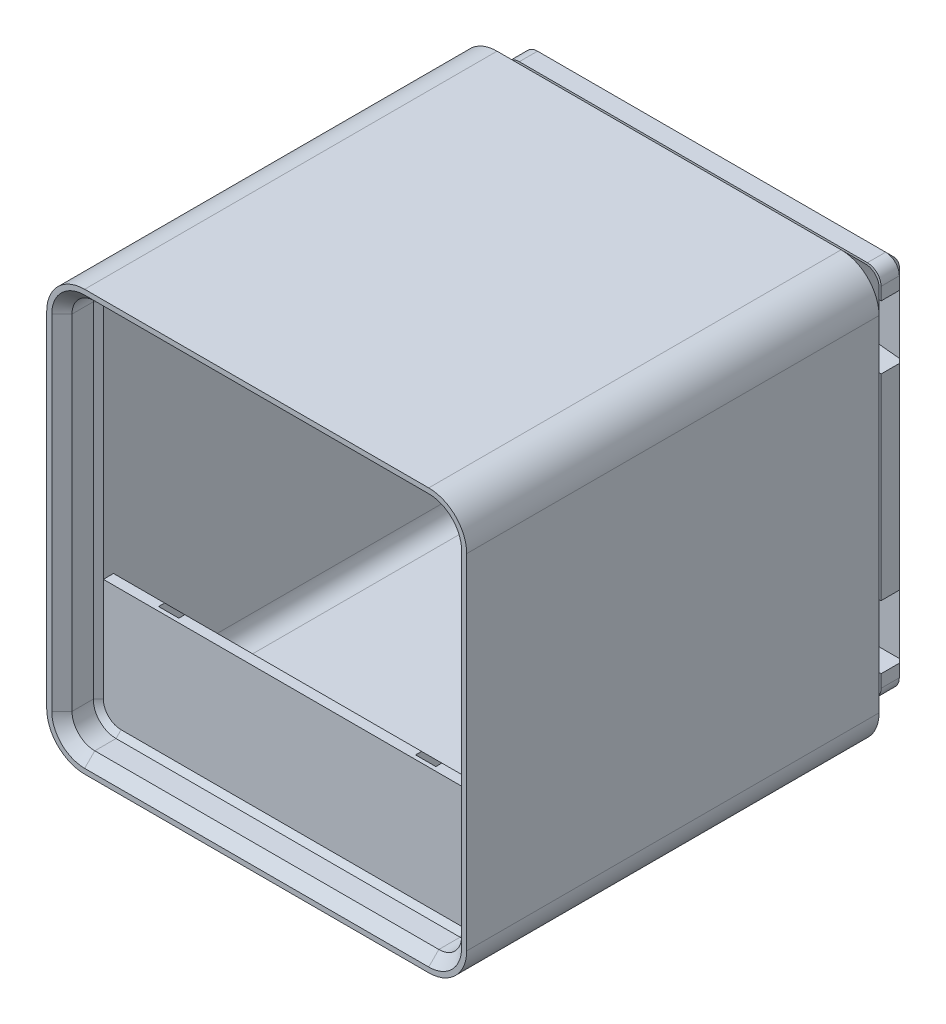
from build123d import *

# Parameters (mm, degrees)
SKETCH1_W              = 37.1
SKETCH1_H              = 37.1
BOSS_EXTRUDE1_DEPTH    = 2.6
SKETCH2_W              = 41.5
SKETCH2_H              = 41.5
BOSS_EXTRUDE2_DEPTH    = 2.4
BASE_START             = -0.4
BASE_MAGNET_SLOT_DEPTH = 2.6
CUT_EXTRUDE1_START     = -5
CUT_EXTRUDE1_DEPTH     = 5
MIRROR2_START          = -0.4
MIRROR2_COPY_1_DEPTH   = 2.6
MIRROR2_START_2        = -5
MIRROR2_COPY_2_DEPTH   = 5
FILLET1_R              = 1.35
FILLET2_R              = 3.75
CHAMFER1_SIZE          = 0.8
CHAMFER2_SIZE          = 2.4
SIDE_WALLS_DEPTH       = 36.85
BOSS_EXTRUDE4_DEPTH    = 3.9
CHAMFER3_SIZE          = 0.8
CHAMFER4_SIZE          = 1
INTERNAL_RAMP_REACH    = 65.905
BOSS_EXTRUDE6_DEPTH    = 12
CHAMFER5_SIZE          = 11
CUT_EXTRUDE2_DEPTH     = 2.6


# Some blends are built 0.0001 mm under size
with BuildPart() as part:
    # Sketch1 → Boss-Extrude1 (new body)
    with BuildSketch(Plane.XY):
        Rectangle(SKETCH1_W, SKETCH1_H)
    extrude(amount=BOSS_EXTRUDE1_DEPTH)

    # Sketch8 → Base Magnet Slot (cut)
    with BuildSketch(Plane(origin=(0, 0, 2.6), x_dir=(-1, 0, 0), z_dir=(0, 0, -1)).offset(BASE_START)):
        with BuildLine():
            Line((-14.65, 10.1), (-18.55, 9.7))
            Line((-18.55, 9.7), (-18.55, 15.95))
            Line((-18.55, 15.95), (-12.7, 15.95))
            ThreePointArc((-12.7, 15.95), (-9.45, 12.7), (-12.7, 9.45))
            ThreePointArc((-12.7, 9.45), (-13.72774024, 9.616779281), (-14.65, 10.1))
        make_face()
    base_magnet_slot = extrude(amount=BASE_MAGNET_SLOT_DEPTH, mode=Mode.SUBTRACT)

    # Sketch12 → Cut-Extrude1 (cut)
    with BuildSketch(Plane(origin=(0, 0, 0), x_dir=(-1, 0, 0), z_dir=(0, 0, -1)).offset(CUT_EXTRUDE1_START)):
        with BuildLine():
            Line((-12.7, 13.7), (-6.2, 13.7))
            ThreePointArc((-6.2, 13.7), (-5.2, 12.7), (-6.2, 11.7))
            Line((-6.2, 11.7), (-12.7, 11.7))
            ThreePointArc((-12.7, 11.7), (-13.7, 12.7), (-12.7, 13.7))
        make_face()
    cut_extrude1 = extrude(amount=CUT_EXTRUDE1_DEPTH, mode=Mode.SUBTRACT)

    # Mirror1: Base Magnet Slot, Cut-Extrude1 across plane
    add(base_magnet_slot.mirror(Plane.ZX), mode=Mode.SUBTRACT)
    add(cut_extrude1.mirror(Plane.ZX), mode=Mode.SUBTRACT)

    # Mirror2: Base Magnet Slot, Cut-Extrude1 across plane
    add(base_magnet_slot.mirror(Plane(origin=(0, 0, 0), x_dir=(0, 0, 1), z_dir=(1, 0, 0))), mode=Mode.SUBTRACT)
    add(cut_extrude1.mirror(Plane(origin=(0, 0, 0), x_dir=(0, 0, 1), z_dir=(1, 0, 0))), mode=Mode.SUBTRACT)

    # Mirror2 copy 1 sketch → Mirror2 copy 1 (cut)
    with BuildSketch(Plane(origin=(0, 0, 2.6), x_dir=(1, 0, 0), z_dir=(0, 0, -1)).offset(MIRROR2_START)):
        with BuildLine():
            Line((-14.65, 10.1), (-18.55, 9.7))
            Line((-18.55, 9.7), (-18.55, 15.95))
            Line((-18.55, 15.95), (-12.7, 15.95))
            ThreePointArc((-12.7, 15.95), (-9.45, 12.7), (-12.7, 9.45))
            ThreePointArc((-12.7, 9.45), (-13.72774024, 9.616779281), (-14.65, 10.1))
        make_face()
    extrude(amount=MIRROR2_COPY_1_DEPTH, mode=Mode.SUBTRACT)

    # Mirror2 copy 2 sketch → Mirror2 copy 2 (cut)
    with BuildSketch(Plane(origin=(0, 0, 0), x_dir=(1, 0, 0), z_dir=(0, 0, -1)).offset(MIRROR2_START_2)):
        with BuildLine():
            Line((-12.7, 13.7), (-6.2, 13.7))
            ThreePointArc((-6.2, 13.7), (-5.2, 12.7), (-6.2, 11.7))
            Line((-6.2, 11.7), (-12.7, 11.7))
            ThreePointArc((-12.7, 11.7), (-13.7, 12.7), (-12.7, 13.7))
        make_face()
    extrude(amount=MIRROR2_COPY_2_DEPTH, mode=Mode.SUBTRACT)

    # Fillet1
    fillet1_edges = [part.edges().sort_by_distance(p)[0] for p in [
        (-18.55, 18.55, 1.3),
        (18.55, 18.55, 1.3),
        (18.55, -18.55, 1.3),
        (-18.55, -18.55, 1.3),
    ]]
    fillet(fillet1_edges, radius=FILLET1_R)

    # Chamfer1
    # the kernel refuses this chamfer: 0.8 mm, written as the material it takes off along each edge
    with BuildSketch(Plane(origin=(-17.2, 17.2, 0), x_dir=(0, 1, 0), z_dir=(1, 0, 0))) as chamfer1_piece_1:
        Polygon((1.35 - CHAMFER1_SIZE, 0), (1.35, CHAMFER1_SIZE), (1.35, 0), align=None)
    revolve(axis=Axis((-17.2, 17.2, 0), (0, 0, 1)), revolution_arc=90, mode=Mode.SUBTRACT)
    with BuildSketch(Plane(origin=(-18.55, 17.2, 0), x_dir=(0.9996219169112968, 0, -0.027495876610586313), z_dir=(0, -1, 0)), Plane(origin=(-17.2, -18.55, 0), x_dir=(0, 0.9996219169112968, -0.027495876610586313), z_dir=(1, 0, 0)), Plane(origin=(18.55, -17.2, 0), x_dir=(-0.9996219169112968, 0, -0.027495876610586313), z_dir=(0, 1, 0))) as chamfer1_piece_2:
        Polygon((CHAMFER1_SIZE * 0.999621916911, CHAMFER1_SIZE * 0.0274958766106), (-CHAMFER1_SIZE * 0.0274958766106, CHAMFER1_SIZE * 0.999621916911), (0, 0), align=None)
    extrude(amount=34.4, mode=Mode.SUBTRACT)
    with BuildSketch(Plane(origin=(-17.2, -17.2, 0), x_dir=(-1, 0, 0), z_dir=(0, 1, 0))) as chamfer1_piece_3:
        Polygon((1.35 - CHAMFER1_SIZE, 0), (1.35, CHAMFER1_SIZE), (1.35, 0), align=None)
    revolve(axis=Axis((-17.2, -17.2, 0), (0, 0, 1)), revolution_arc=90, mode=Mode.SUBTRACT)
    with BuildSketch(Plane(origin=(17.2, -17.2, 0), x_dir=(1, 0, 0), z_dir=(0, 1, 0))) as chamfer1_piece_4:
        Polygon((1.35 - CHAMFER1_SIZE, 0), (1.35, -CHAMFER1_SIZE), (1.35, 0), align=None)
    revolve(axis=Axis((17.2, -17.2, 0), (0, 0, -1)), revolution_arc=90, mode=Mode.SUBTRACT)
    with BuildSketch(Plane(origin=(17.2, 17.2, 0), x_dir=(0, 1, 0), z_dir=(-1, 0, 0))) as chamfer1_piece_5:
        Polygon((1.35 - CHAMFER1_SIZE, 0), (1.35, -CHAMFER1_SIZE), (1.35, 0), align=None)
    revolve(axis=Axis((17.2, 17.2, 0), (0, 0, -1)), revolution_arc=90, mode=Mode.SUBTRACT)
    with BuildSketch(Plane(origin=(17.2, 18.55, 0), x_dir=(0, 0.02749587661058735, 0.9996219169112966), z_dir=(-1, 0, 0))) as chamfer1_piece_6:
        Polygon((CHAMFER1_SIZE * 0.999621916911, -CHAMFER1_SIZE * 0.0274958766106), (-CHAMFER1_SIZE * 0.0274958766106, -CHAMFER1_SIZE * 0.999621916911), (0, 0), align=None)
    extrude(amount=34.4, mode=Mode.SUBTRACT)


with BuildPart() as body_2:
    # Sketch2 → Boss-Extrude2 (new body)
    with BuildSketch(Plane.XY.offset(2.6)):
        Rectangle(SKETCH2_W, SKETCH2_H)
    extrude(amount=BOSS_EXTRUDE2_DEPTH)

    # Fillet2
    fillet2_edges = [body_2.edges().sort_by_distance(p)[0] for p in [
        (20.75, -20.75, 3.8),
        (-20.75, -20.75, 3.8),
        (-20.75, 20.75, 3.8),
        (20.75, 20.75, 3.8),
    ]]
    fillet(fillet2_edges, radius=FILLET2_R)

    # Chamfer2
    chamfer2_edges = [body_2.edges().sort_by_distance(p)[0] for p in [
        (20.75, 0, 2.6),
        (19.651650429, 19.651650429, 2.6),
        (19.651650429, -19.651650429, 2.6),
        (0, 20.75, 2.6),
        (0, -20.75, 2.6),
        (-19.651650429, 19.651650429, 2.6),
        (-19.651650429, -19.651650429, 2.6),
        (-20.75, 0, 2.6),
    ]]
    chamfer(chamfer2_edges, length=CHAMFER2_SIZE - 0.0001)  # a hair under: the kernel refuses the full size


with BuildPart() as body_3:
    # Sketch5 → Side Walls (new body)
    with BuildSketch(Plane.XY.offset(5)):
        with BuildLine():
            Line((-17, -20.75), (17, -20.75))
            ThreePointArc((17, -20.75), (19.651650429, -19.651650429), (20.75, -17))
            Line((20.75, -17), (20.75, 17))
            ThreePointArc((20.75, 17), (19.651650429, 19.651650429), (17, 20.75))
            Line((17, 20.75), (-17, 20.75))
            ThreePointArc((-17, 20.75), (-19.651650429, 19.651650429), (-20.75, 17))
            Line((-20.75, 17), (-20.75, -17))
            ThreePointArc((-20.75, -17), (-19.651650429, -19.651650429), (-17, -20.75))
        make_face()
        with BuildLine():
            Line((-17, -18.75), (17, -18.75))
            ThreePointArc((17, -18.75), (18.237436867, -18.237436867), (18.75, -17))
            Line((18.75, -17), (18.75, 17))
            ThreePointArc((18.75, 17), (18.237436867, 18.237436867), (17, 18.75))
            Line((17, 18.75), (-17, 18.75))
            ThreePointArc((-17, 18.75), (-18.237436867, 18.237436867), (-18.75, 17))
            Line((-18.75, 17), (-18.75, -17))
            ThreePointArc((-18.75, -17), (-18.237436867, -18.237436867), (-17, -18.75))
        make_face(mode=Mode.SUBTRACT)
    extrude(amount=SIDE_WALLS_DEPTH)

    # Sketch11 → Boss-Extrude4 (add)
    with BuildSketch(Plane.XY.offset(41.85)):
        with BuildLine():
            Line((-17, -20.75), (17, -20.75))
            ThreePointArc((17, -20.75), (19.651650429, -19.651650429), (20.75, -17))
            Line((20.75, -17), (20.75, 17))
            ThreePointArc((20.75, 17), (19.651650429, 19.651650429), (17, 20.75))
            Line((17, 20.75), (-17, 20.75))
            ThreePointArc((-17, 20.75), (-19.651650429, 19.651650429), (-20.75, 17))
            Line((-20.75, 17), (-20.75, -17))
            ThreePointArc((-20.75, -17), (-19.651650429, -19.651650429), (-17, -20.75))
        make_face()
        with BuildLine():
            Line((-17, -19.25), (17, -19.25))
            ThreePointArc((17, -19.25), (18.590990258, -18.590990258), (19.25, -17))
            Line((19.25, -17), (19.25, 17))
            ThreePointArc((19.25, 17), (18.590990258, 18.590990258), (17, 19.25))
            Line((17, 19.25), (-17, 19.25))
            ThreePointArc((-17, 19.25), (-18.590990258, 18.590990258), (-19.25, 17))
            Line((-19.25, 17), (-19.25, -17))
            ThreePointArc((-19.25, -17), (-18.590990258, -18.590990258), (-17, -19.25))
        make_face(mode=Mode.SUBTRACT)
    extrude(amount=BOSS_EXTRUDE4_DEPTH)

    # Chamfer3
    # the kernel refuses this chamfer: 0.8 mm, written as the material it adds along each edge
    with BuildSketch(Plane(origin=(-17, -19.25, 41.85), x_dir=(0, 0.9996219169112966, -0.027495876610587302), z_dir=(1, 0, 0))) as chamfer3_piece_1_section:
        Polygon((CHAMFER3_SIZE * 0.999621916911, CHAMFER3_SIZE * 0.0274958766106), (-CHAMFER3_SIZE * 0.0274958766106, CHAMFER3_SIZE * 0.999621916911), (0, 0), align=None)
    chamfer3_piece_1 = extrude(amount=34, mode=Mode.PRIVATE)
    chamfer3_piece_1 = split(chamfer3_piece_1, bisect_by=Plane(origin=(0, -18.75, 42.146611644), z_dir=(0, -1, 0)), keep=Keep.TOP, mode=Mode.PRIVATE)
    add(chamfer3_piece_1)
    with BuildSketch(Plane(origin=(17, -17, 41.85), x_dir=(0, -1, 0), z_dir=(-1, 0, 0))) as chamfer3_piece_2_section:
        Polygon((2.25 - CHAMFER3_SIZE, 0), (2.25, CHAMFER3_SIZE), (2.25, 0), align=None)
    chamfer3_piece_2 = revolve(axis=Axis((17, -17, 41.85), (0, 0, 1)), revolution_arc=90, mode=Mode.PRIVATE)
    chamfer3_piece_2 = chamfer3_piece_2 - Plane(origin=(17, -17, 42.110756308), x_dir=(0, -1, 0), z_dir=(0, 0, -1)) * Cylinder(1.75, 10, mode=Mode.PRIVATE)
    add(chamfer3_piece_2)
    with BuildSketch(Plane(origin=(-17, -17, 41.85), x_dir=(-1, 0, 0), z_dir=(0, 1, 0))) as chamfer3_piece_3_section:
        Polygon((2.25 - CHAMFER3_SIZE, 0), (2.25, CHAMFER3_SIZE), (2.25, 0), align=None)
    chamfer3_piece_3 = revolve(axis=Axis((-17, -17, 41.85), (0, 0, 1)), revolution_arc=90, mode=Mode.PRIVATE)
    chamfer3_piece_3 = chamfer3_piece_3 - Plane(origin=(-17, -17, 42.110756308), x_dir=(-1, 0, 0), z_dir=(0, 0, -1)) * Cylinder(1.75, 9, mode=Mode.PRIVATE)
    add(chamfer3_piece_3)
    with BuildSketch(Plane(origin=(19.25, -17, 41.85), x_dir=(-0.9996219169112966, 0, -0.027495876610587302), z_dir=(0, 1, 0))) as chamfer3_piece_4_section:
        Polygon((CHAMFER3_SIZE * 0.999621916911, CHAMFER3_SIZE * 0.0274958766106), (-CHAMFER3_SIZE * 0.0274958766106, CHAMFER3_SIZE * 0.999621916911), (0, 0), align=None)
    chamfer3_piece_4 = extrude(amount=34, mode=Mode.PRIVATE)
    chamfer3_piece_4 = split(chamfer3_piece_4, bisect_by=Plane(origin=(18.75, 0, 42.146611644), z_dir=(1, 0, 0)), keep=Keep.TOP, mode=Mode.PRIVATE)
    add(chamfer3_piece_4)
    with BuildSketch(Plane(origin=(-19.25, 17, 41.85), x_dir=(0.9996219169112966, 0, -0.027495876610587302), z_dir=(0, -1, 0))) as chamfer3_piece_5_section:
        Polygon((CHAMFER3_SIZE * 0.999621916911, CHAMFER3_SIZE * 0.0274958766106), (-CHAMFER3_SIZE * 0.0274958766106, CHAMFER3_SIZE * 0.999621916911), (0, 0), align=None)
    chamfer3_piece_5 = extrude(amount=34, mode=Mode.PRIVATE)
    chamfer3_piece_5 = split(chamfer3_piece_5, bisect_by=Plane(origin=(-18.75, 0, 42.146611644), z_dir=(-1, 0, 0)), keep=Keep.TOP, mode=Mode.PRIVATE)
    add(chamfer3_piece_5)
    with BuildSketch(Plane(origin=(17, 17, 41.85), x_dir=(1, 0, 0), z_dir=(0, -1, 0))) as chamfer3_piece_6_section:
        Polygon((2.25 - CHAMFER3_SIZE, 0), (2.25, CHAMFER3_SIZE), (2.25, 0), align=None)
    chamfer3_piece_6 = revolve(axis=Axis((17, 17, 41.85), (0, 0, 1)), revolution_arc=90, mode=Mode.PRIVATE)
    chamfer3_piece_6 = chamfer3_piece_6 - Plane(origin=(17, 17, 42.110756308), x_dir=(1, 0, 0), z_dir=(0, 0, -1)) * Cylinder(1.75, 9, mode=Mode.PRIVATE)
    add(chamfer3_piece_6)
    with BuildSketch(Plane(origin=(-17, 17, 41.85), x_dir=(0, 1, 0), z_dir=(1, 0, 0))) as chamfer3_piece_7_section:
        Polygon((2.25 - CHAMFER3_SIZE, 0), (2.25, CHAMFER3_SIZE), (2.25, 0), align=None)
    chamfer3_piece_7 = revolve(axis=Axis((-17, 17, 41.85), (0, 0, 1)), revolution_arc=90, mode=Mode.PRIVATE)
    chamfer3_piece_7 = chamfer3_piece_7 - Plane(origin=(-17, 17, 42.110756308), x_dir=(0, 1, 0), z_dir=(0, 0, -1)) * Cylinder(1.75, 9, mode=Mode.PRIVATE)
    add(chamfer3_piece_7)
    with BuildSketch(Plane(origin=(17, 19.25, 41.85), x_dir=(0, -0.9996219169112966, -0.027495876610587302), z_dir=(-1, 0, 0))) as chamfer3_piece_8_section:
        Polygon((CHAMFER3_SIZE * 0.999621916911, CHAMFER3_SIZE * 0.0274958766106), (-CHAMFER3_SIZE * 0.0274958766106, CHAMFER3_SIZE * 0.999621916911), (0, 0), align=None)
    chamfer3_piece_8 = extrude(amount=34, mode=Mode.PRIVATE)
    chamfer3_piece_8 = split(chamfer3_piece_8, bisect_by=Plane(origin=(0, 18.75, 42.146611644), z_dir=(0, 1, 0)), keep=Keep.TOP, mode=Mode.PRIVATE)
    add(chamfer3_piece_8)

    # Chamfer4
    chamfer4_edges = [body_3.edges().sort_by_distance(p)[0] for p in [
        (-18.590990258, -18.590990258, 45.75),
        (0, -19.25, 45.75),
        (18.590990258, -18.590990258, 45.75),
        (19.25, 0, 45.75),
        (18.590990258, 18.590990258, 45.75),
        (0, 19.25, 45.75),
        (-18.590990258, 18.590990258, 45.75),
        (-19.25, 0, 45.75),
    ]]
    chamfer(chamfer4_edges, length=CHAMFER4_SIZE)

    # Internal Ramp: up to this face of the body (flat: up to its plane)
    internal_ramp_end = Plane(body_3.part.faces().sort_by_distance((-18.75, 0, 23.575))[0])
    # Sketch13 → Internal Ramp (add, up to the picked face)
    with BuildSketch(Plane.ZY.offset(-18.75), mode=Mode.PRIVATE) as internal_ramp_sk1:
        with BuildLine():
            Line((5, -1.25), (5, 18.75))
            Line((5, 18.75), (25, 18.75))
            ThreePointArc((25, 18.75), (10.857864376, 12.892135624), (5, -1.25))
        make_face()
    internal_ramp_tool1 = split(extrude(internal_ramp_sk1.sketch, amount=INTERNAL_RAMP_REACH, mode=Mode.PRIVATE), bisect_by=internal_ramp_end, keep=Keep.BOTH, mode=Mode.PRIVATE)

    add(body_2.part)  # Internal Ramp merges body 2
    add(internal_ramp_tool1.solids().sort_by(Axis((18.75, 14.282641, 9.467359), (-1, 0, 0)))[0])

    # Sketch14 → Boss-Extrude6 (add)
    with BuildSketch(Plane(origin=(0, 0, 42.15), x_dir=(-1, 0, 0), z_dir=(0, 0, -1))):
        with BuildLine():
            Line((-18.75, -17), (-18.75, -6.75))
            Line((-18.75, -6.75), (18.75, -6.75))
            Line((18.75, -6.75), (18.75, -17))
            ThreePointArc((18.75, -17), (18.237436867, -18.237436867), (17, -18.75))
            Line((17, -18.75), (-17, -18.75))
            ThreePointArc((-17, -18.75), (-18.237436867, -18.237436867), (-18.75, -17))
        make_face()
    extrude(amount=BOSS_EXTRUDE6_DEPTH)

    # Chamfer5
    chamfer5_edges = [body_3.edges().sort_by_distance(p)[0] for p in [
        (0, -6.75, 30.15),
    ]]
    chamfer(chamfer5_edges, length=CHAMFER5_SIZE)

    # Sketch17 → Cut-Extrude2 (cut)
    with BuildSketch(Plane.XY.offset(41.75)):
        with BuildLine():
            Line((-15.95, -12.7), (-15.95, -20.75))
            Line((-15.95, -20.75), (-9.45, -20.75))
            Line((-9.45, -20.75), (-10.1, -14.65))
            ThreePointArc((-10.1, -14.65), (-9.602215148, -11.717030514), (-11.7, -9.607670781))
            Line((-11.7, -9.607670781), (-11.7, -4.7))
            ThreePointArc((-11.7, -4.7), (-12.7, -3.7), (-13.7, -4.7))
            Line((-13.7, -4.7), (-13.7, -9.607670781))
            ThreePointArc((-13.7, -9.607670781), (-15.327974505, -10.787867682), (-15.95, -12.7))
        make_face()
    cut_extrude2 = extrude(amount=-CUT_EXTRUDE2_DEPTH, mode=Mode.SUBTRACT)

    # Mirror3: Cut-Extrude2 across plane
    add(cut_extrude2.mirror(Plane(origin=(0, 0, 0), x_dir=(0, 0, 1), z_dir=(1, 0, 0))), mode=Mode.SUBTRACT)


solid = Compound([part.part, body_3.part])
